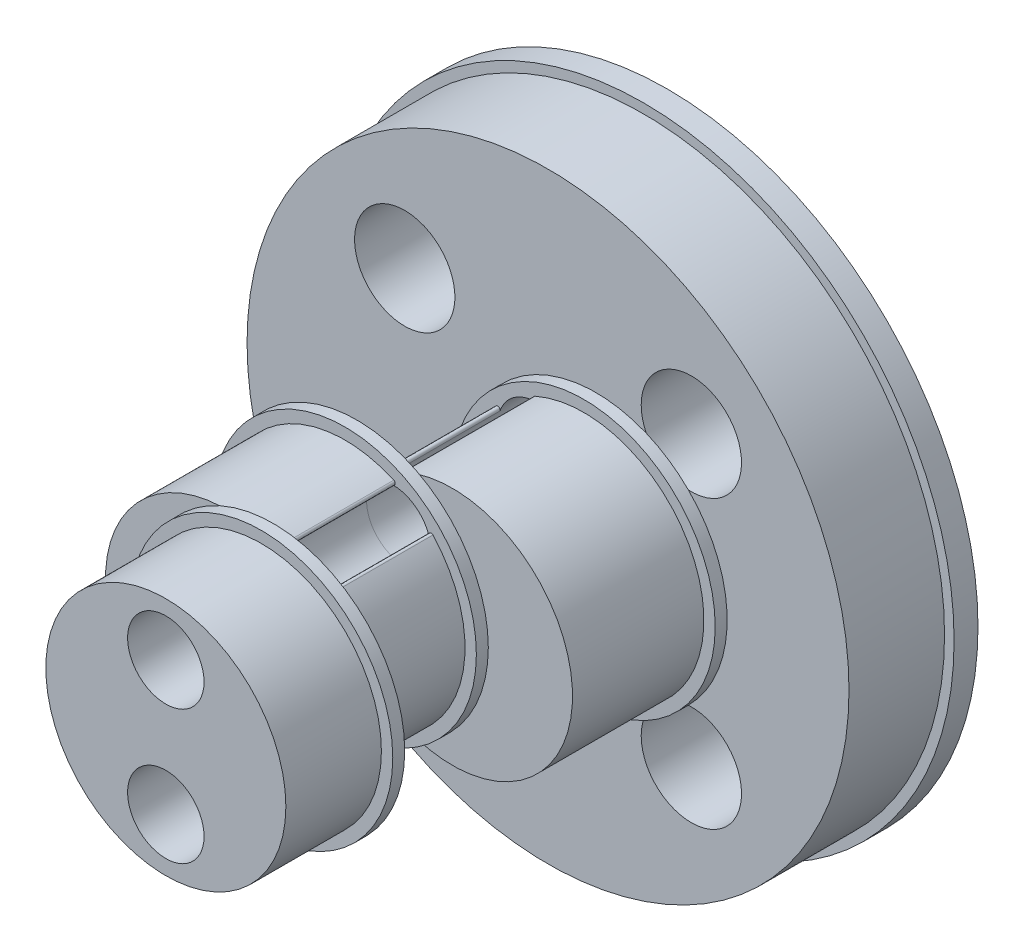
from build123d import *

# Parameters (mm, degrees)
SKETCH1_R            = 12.6
BOSS_EXTRUDE1_DEPTH  = 5
SKETCH2_R            = 5.499454457575955
SKETCH2_R_2          = 5.0249999999999995
BOSS_EXTRUDE2_DEPTH  = 0.5
SKETCH2_3_R          = 5.0249999999999995
BOSS_EXTRUDE3_DEPTH  = 6
BOSS_EXTRUDE4_START  = 6
SKETCH3_R            = 5.5
SKETCH3_R_2          = 5.0249999999999995
BOSS_EXTRUDE4_DEPTH  = 0.5
BOSS_EXTRUDE5_START  = 6
SKETCH3_3_R          = 5.0249999999999995
BOSS_EXTRUDE5_DEPTH  = 5.5
BOSS_EXTRUDE6_START  = 11.5
SKETCH4_R            = 5.5
SKETCH4_R_2          = 5.0249999999999995
BOSS_EXTRUDE6_DEPTH  = 0.5
BOSS_EXTRUDE7_START  = 11.5
SKETCH4_7_R          = 5.0249999999999995
BOSS_EXTRUDE7_DEPTH  = 4.5
SKETCH5_R            = 1.6000000000000003
CUT_EXTRUDE1_DEPTH   = 28.54124180206839
SPLIT1_START         = -55.412644993
SPLIT1_OUTLINE_R     = 1.6
SPLIT1_DEPTH         = 10
SPLIT1_2_DEPTH       = 5.5
SPLIT1_3_OUTLINE_R   = 5.5
SPLIT1_3_DEPTH       = 0.5
SPLIT1_START_2       = -49.912644993
SPLIT1_4_OUTLINE_R   = 5.025
SPLIT1_4_OUTLINE_R_2 = 1.6
SPLIT1_4_DEPTH       = 4.5
SPLIT1_5_OUTLINE_R   = 5.5
SPLIT1_5_OUTLINE_R_2 = 5.025
SPLIT1_5_DEPTH       = 0.5
FILLET1_R            = 0.1
FILLET2_R            = 0.1
CUT_EXTRUDE2_DEPTH   = 3.2
SKETCH7_R            = 2.1000000000000005
SKETCH7_R_2          = 2.099999999999999
SKETCH7_R_3          = 2.1000000000000014
CUT_EXTRUDE3_DEPTH   = 5
SKETCH8_R            = 13
SKETCH8_R_2          = 12.600000000000003
BOSS_EXTRUDE8_DEPTH  = 1


# Read off the part's stored shape, not the designer's step: Split1
with BuildPart() as part:
    # Sketch1 → Boss-Extrude1 (new body)
    with BuildSketch(Plane(origin=(0, 0, -66.41264499315878), x_dir=(-1, 0, 0), z_dir=(0, 0, -1))):
        Circle(SKETCH1_R)
    extrude(amount=-BOSS_EXTRUDE1_DEPTH)

    # Sketch2 → Boss-Extrude2 (add)
    with BuildSketch(Plane.XY.offset(-61.412644993158786)):
        with Locations(Location((2, 0, 0), (0, 0, 180))):
            Circle(SKETCH2_R)
        with Locations((2, 0)):
            Circle(SKETCH2_R_2, mode=Mode.SUBTRACT)
    extrude(amount=BOSS_EXTRUDE2_DEPTH)

    # Sketch2<3> → Boss-Extrude3 (add)
    with BuildSketch(Plane.XY.offset(-61.412644993158786)):
        with Locations((2, 0)):
            Circle(SKETCH2_3_R)
    extrude(amount=BOSS_EXTRUDE3_DEPTH)



with BuildPart() as body_2:
    # Sketch3 → Boss-Extrude4 (new body)
    with BuildSketch(Plane.XY.offset(-61.412644993158786).offset(BOSS_EXTRUDE4_START)):
        with Locations((-2, -2.4e-16)):
            Circle(SKETCH3_R)
        with Locations((-2, -2.4e-16)):
            Circle(SKETCH3_R_2, mode=Mode.SUBTRACT)
    extrude(amount=BOSS_EXTRUDE4_DEPTH)


with BuildPart() as part_1:
    add(part.part)

    add(body_2.part)  # Boss-Extrude5 merges body 2
    # Sketch3<3> → Boss-Extrude5 (add)
    with BuildSketch(Plane.XY.offset(-61.412644993158786).offset(BOSS_EXTRUDE5_START)):
        with Locations((-2, -2.4e-16)):
            Circle(SKETCH3_3_R)
    extrude(amount=BOSS_EXTRUDE5_DEPTH)

    # Sketch4 → Boss-Extrude6 (add)
    with BuildSketch(Plane.XY.offset(-61.412644993158786).offset(BOSS_EXTRUDE6_START)):
        with Locations(Location((0, 0, 0), (0, 0, 114.145956113))):
            Circle(SKETCH4_R)
        with Locations(Location((0, 0, 0), (0, 0, 101.478778724))):
            Circle(SKETCH4_R_2, mode=Mode.SUBTRACT)
    extrude(amount=BOSS_EXTRUDE6_DEPTH)

    # Sketch4<7> → Boss-Extrude7 (add)
    with BuildSketch(Plane.XY.offset(-61.412644993158786).offset(BOSS_EXTRUDE7_START)):
        Circle(SKETCH4_7_R)
    extrude(amount=BOSS_EXTRUDE7_DEPTH)

    # Sketch5 → Cut-Extrude1 (cut, through all)
    with BuildSketch(Plane.XY.offset(-45.41264499315879)):
        with Locations((2e-17, 2.8)):
            Circle(SKETCH5_R)
        with Locations((7.1e-16, -2.8)):
            Circle(SKETCH5_R)
    extrude(amount=-CUT_EXTRUDE1_DEPTH, mode=Mode.SUBTRACT)

    # Split1 outline → Split1 (cut)
    with BuildSketch(Plane.XY.offset(SPLIT1_START)):
        with BuildLine():
            ThreePointArc((-1, 5.408326913), (-7.5, 0), (-1, -5.408326913))
            ThreePointArc((-1, -5.408326913), (5.5, 0), (-1, 5.408326913))
        make_face()
        with Locations((0, 2.8)):
            Circle(SPLIT1_OUTLINE_R, mode=Mode.SUBTRACT)
        with Locations((0, -2.8)):
            Circle(SPLIT1_OUTLINE_R, mode=Mode.SUBTRACT)
    extrude(amount=SPLIT1_DEPTH, mode=Mode.SUBTRACT)

    # Fillet2
    fillet2_edges = [part_1.edges().sort_by_distance(p)[0] for p in [
        (-0.6950501563684846, -4.241147209736796, -58.162644993158786),
        (-1.1378256882261084, -3.9248789726956352, -58.162644993158786),
        (-1.1378256882260929, 3.924878972695648, -58.162644993158786),
        (-0.6950501563685023, 4.241147209736784, -58.162644993158786),
    ]]
    fillet(fillet2_edges, radius=FILLET2_R)

    # Sketch6 → Cut-Extrude2 (cut)
    with BuildSketch(Plane(origin=(0, 0, -66.41264499315878), x_dir=(-1, 0, 0), z_dir=(0, 0, -1))):
        with BuildLine():
            Line((2.8, 2.8), (2.799999999999999, -2.8))
            ThreePointArc((2.799999999999999, -2.8), (-1.22e-15, -5.6), (-2.8000000000000007, -2.8))
            Line((-2.8000000000000007, -2.8), (-2.8, 2.8))
            ThreePointArc((-2.8, 2.8), (1.5e-16, 5.6), (2.8, 2.8))
        make_face()
    extrude(amount=-CUT_EXTRUDE2_DEPTH, mode=Mode.SUBTRACT)

    # Sketch7 → Cut-Extrude3 (cut)
    with BuildSketch(Plane(origin=(0, 0, -66.41264499315878), x_dir=(-1, 0, 0), z_dir=(0, 0, -1))):
        with Locations((-6.000000000000002, 5.999999999999999)):
            Circle(SKETCH7_R)
        with Locations((5.999999999999998, 5.999999999999999)):
            Circle(SKETCH7_R)
        with Locations((5.999999999999998, -6.000000000000001)):
            Circle(SKETCH7_R_2)
        with Locations((-6.000000000000003, -6)):
            Circle(SKETCH7_R_3)
    extrude(amount=-CUT_EXTRUDE3_DEPTH, mode=Mode.SUBTRACT)

    # Sketch8 → Boss-Extrude8 (add)
    with BuildSketch(Plane(origin=(0, 0, -66.41264499315878), x_dir=(-1, 0, 0), z_dir=(0, 0, -1))):
        Circle(SKETCH8_R)
        Circle(SKETCH8_R_2, mode=Mode.SUBTRACT)
    extrude(amount=-BOSS_EXTRUDE8_DEPTH)


with BuildPart() as body_2_2:
    # Split1 2 outline → Split1 2 (new body)
    with BuildSketch(Plane.XY.offset(SPLIT1_START)):
        with BuildLine():
            ThreePointArc((1.137825688, -3.924878973), (3.025, 0), (1.137825688, 3.924878973))
            ThreePointArc((1.137825688, 3.924878973), (-0.92998111, 1.498026446), (0.695050156, 4.24114721))
            ThreePointArc((0.695050156, 4.24114721), (-7.025, 0), (0.695050156, -4.24114721))
            ThreePointArc((0.695050156, -4.24114721), (-0.92998111, -1.498026446), (1.137825688, -3.924878973))
        make_face()
    extrude(amount=SPLIT1_2_DEPTH)

    # Split1 3 outline → Split1 3 (add)
    with BuildSketch(Plane.XY.offset(SPLIT1_START)):
        with Locations((-2, 0)):
            Circle(SPLIT1_3_OUTLINE_R)
        with BuildLine():
            ThreePointArc((0.695050156, 4.24114721), (0.92998111, 4.101973554), (1.137825688, 3.924878973))
            ThreePointArc((1.137825688, 3.924878973), (3.025, 0), (1.137825688, -3.924878973))
            ThreePointArc((1.137825688, -3.924878973), (0.92998111, -4.101973554), (0.695050156, -4.24114721))
            ThreePointArc((0.695050156, -4.24114721), (-7.025, 0), (0.695050156, 4.24114721))
        make_face(mode=Mode.SUBTRACT)
    extrude(amount=SPLIT1_3_DEPTH)

    # Fillet1
    # the kernel refuses this fillet: 0.1 mm, written as the material it takes off along each edge
    with BuildSketch(Plane(origin=(1.1378256880000006, -3.924878973, -54.912644993), x_dir=(0.5272838464707954, 0.8496892050926401, 0), z_dir=(0, 0, 1))) as fillet1_piece_1:
        with BuildLine():
            CenterArc((0.7339208558356513, -0.09749554475196075), FILLET1_R, 102.8500510005881, 156.06997269077794)
            Line((0.7147029545095785, -0.19563153340353207), (0.7143185964830571, -0.19759425317656348))
            ThreePointArc((0.7143185964830571, -0.19759425317656348), (0.3532125240431902, -0.1129366525704308), (-0.00066881691387395, -0.00188485647615828))
            Line((-0.00066881691387395, -0.00188485647615828), (0.00044480051866812, 0.00194991089503923))
            ThreePointArc((0.00044480051866812, 0.00194991089503923), (0.35584041495112406, -0.03807128397050696), (0.7112360293835808, 0.00194991089503922))
            Line((0.7112360293835808, 0.00194991089503922), (0.7116808299022489, -4e-17))
        make_face()
    extrude(amount=5, mode=Mode.SUBTRACT)
    with BuildSketch(Plane(origin=(0.6950501559999995, -4.241147210000001, -54.912644993), x_dir=(-0.9747710361649122, -0.22320713934366773, 0), z_dir=(0, 0, 1))) as fillet1_piece_2:
        with BuildLine():
            CenterArc((0.7339208553218103, 0.09749554475551281), FILLET1_R, 101.07997632228573, 156.06997268627677)
            Line((0.714702953972355, 0.19563153340250483), (0.7143185959453658, 0.1975942531754444))
            ThreePointArc((0.7143185959453658, 0.1975942531754444), (0.35321252377659246, 0.11293665255128191), (-0.00066881691414123, 0.00188485647606383))
            Line((-0.00066881691414123, 0.00188485647606383), (0.00044480051835665, -0.00194991089511022))
            ThreePointArc((0.00044480051835665, -0.00194991089511022), (0.35584041470198946, 0.03807128391367618), (0.711236028885622, -0.00194991089511051))
            Line((0.711236028885622, -0.00194991089511051), (0.7116808294039787, 0))
        make_face()
    extrude(amount=5, mode=Mode.SUBTRACT)
    with BuildSketch(Plane(origin=(0.6950501560000002, 4.24114721, -54.912644993), x_dir=(-0.8812560463152725, 0.4726391655721877, 0), z_dir=(0, 0, 1))) as fillet1_piece_3:
        with BuildLine():
            CenterArc((0.7336208593975166, 0.09972781848774585), FILLET1_R, 118.15832442623193, 156.06997268627686)
            Line((0.6864298993019216, 0.18789251258496353), (0.6854860801000094, 0.1896558064669081))
            ThreePointArc((0.6854860801000094, 0.1896558064669081), (0.35326623794808576, 0.05722576797323723), (-8.578182782469e-05, 0.00199815952266453))
            Line((-8.578182782469e-05, 0.00199815952266453), (-0.00014746147927519, -0.00199455636975523))
            ThreePointArc((-0.00014746147927519, -0.00199455636975523), (0.37049696668064286, -0.01567712099081798), (0.7411413948405625, -0.00199455636975463))
            Line((0.7411413948405625, -0.00199455636975463), (0.7409939333612872, 0))
        make_face()
    extrude(amount=5, mode=Mode.SUBTRACT)
    with BuildSketch(Plane(origin=(1.1378256880000008, 3.924878973, -54.912644993), x_dir=(0.7329038743989365, -0.6803322062720741, 0), z_dir=(0, 0, 1))) as fillet1_piece_4:
        with BuildLine():
            CenterArc((0.7336208599111411, -0.09972781848739057), FILLET1_R, 85.77170288473079, 156.06997269077783)
            Line((0.6864298998182243, -0.1878925125860417), (0.6854860806163661, -0.18965580646801475))
            ThreePointArc((0.6854860806163661, -0.18965580646801475), (0.35326623821426095, -0.05722576791705115), (-8.578182712573e-05, -0.00199815952269459))
            Line((-8.578182712573e-05, -0.00199815952269459), (-0.00014746147937158, 0.00199455636974773))
            ThreePointArc((-0.00014746147937158, 0.00199455636974773), (0.3704969669398584, 0.01567712100932383), (0.7411413953590879, 0.00199455636974782))
            Line((0.7411413953590879, 0.00199455636974782), (0.7409939338797163, 3e-17))
        make_face()
    extrude(amount=5, mode=Mode.SUBTRACT)


with BuildPart() as body_3:
    # Split1 4 outline → Split1 4 (new body)
    with BuildSketch(Plane.XY.offset(SPLIT1_START_2)):
        Circle(SPLIT1_4_OUTLINE_R)
        with Locations((0, -2.8)):
            Circle(SPLIT1_4_OUTLINE_R_2, mode=Mode.SUBTRACT)
        with Locations((0, 2.8)):
            Circle(SPLIT1_4_OUTLINE_R_2, mode=Mode.SUBTRACT)
    extrude(amount=SPLIT1_4_DEPTH)

    # Split1 5 outline → Split1 5 (add)
    with BuildSketch(Plane.XY.offset(SPLIT1_START_2)):
        Circle(SPLIT1_5_OUTLINE_R)
        Circle(SPLIT1_5_OUTLINE_R_2, mode=Mode.SUBTRACT)
    extrude(amount=SPLIT1_5_DEPTH)


solid = Compound([part_1.part, body_2_2.part, body_3.part])
